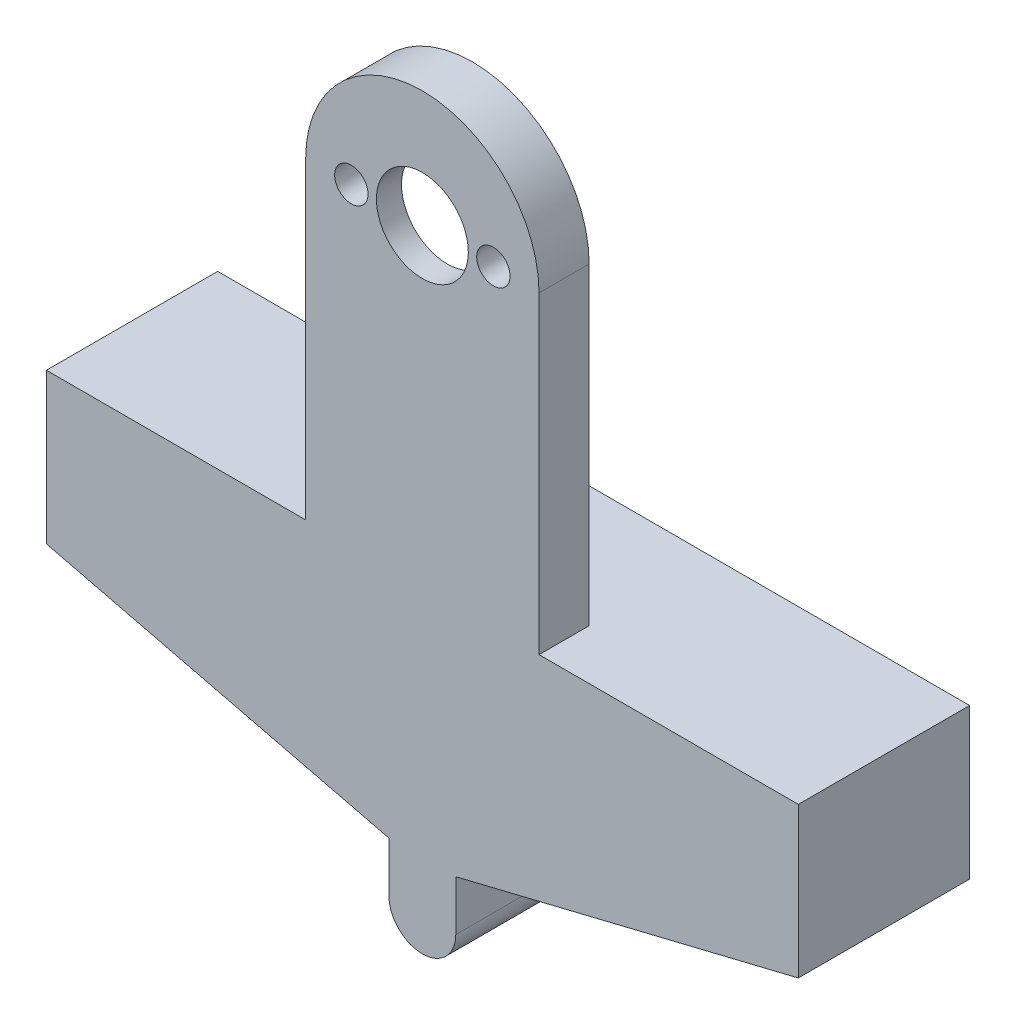
from build123d import *

# Parameters (mm, degrees)
SKETCH1_W           = 15
SKETCH1_H           = 6
SKETCH1_W_2         = 8
SKETCH1_H_2         = 20
BOSS_EXTRUDE1_DEPTH = 14
SKETCH3_W           = 15
SKETCH3_H           = 6
SKETCH3_W_2         = 8
SKETCH3_H_2         = 20
BOSS_EXTRUDE2_DEPTH = 6.5
FILLET1_R           = 4
SKETCH4_R           = 2
SKETCH4_R_2         = 5.5
BOSS_EXTRUDE3_DEPTH = 6
SKETCH5_R           = 12.05
CUT_EXTRUDE1_DEPTH  = 3


with BuildPart() as part:
    # Sketch1 → Boss-Extrude1 (new body)
    # profile 1 of 6: a face of its own
    with BuildSketch(Plane.XY):
        Polygon((-4, -9), (4, -9), (45, -9), (45, 9), (-45, 9), (-45, -9), align=None)
        with Locations((-15, 0)):
            Rectangle(SKETCH1_W, SKETCH1_H, mode=Mode.SUBTRACT)
        with Locations((15, 0)):
            Rectangle(SKETCH1_W, SKETCH1_H, mode=Mode.SUBTRACT)
    # profile 2 of 6: a face of its own
    with BuildSketch(Plane.XY):
        with Locations((0, -19)):
            Rectangle(SKETCH1_W_2, SKETCH1_H_2)
    # profile 3 of 6: a face of its own
    with BuildSketch(Plane.XY):
        with Locations((-15, 0)):
            Rectangle(SKETCH1_W, SKETCH1_H)
    # profile 4 of 6: a face of its own
    with BuildSketch(Plane.XY):
        with Locations((15, 0)):
            Rectangle(SKETCH1_W, SKETCH1_H)
    # profile 5 of 6: a face of its own
    with BuildSketch(Plane.XY):
        Polygon((45, -9), (4, -9), (4, -19), align=None)
    # profile 6 of 6: a face of its own
    with BuildSketch(Plane.XY):
        Polygon((-4, -19), (-4, -9), (-45, -9), align=None)
    extrude(amount=BOSS_EXTRUDE1_DEPTH)

    # Sketch3 → Boss-Extrude2 (add)
    # profile 1 of 2: a face of its own
    with BuildSketch(Plane.XY):
        Polygon((-4, -9), (4, -9), (45, -9), (45, 9), (-45, 9), (-45, -9), align=None)
        with Locations((-15, 0)):
            Rectangle(SKETCH3_W, SKETCH3_H, mode=Mode.SUBTRACT)
        with Locations((15, 0)):
            Rectangle(SKETCH3_W, SKETCH3_H, mode=Mode.SUBTRACT)
    # profile 2 of 2: a face of its own
    with BuildSketch(Plane.XY):
        with Locations((0, -19)):
            Rectangle(SKETCH3_W_2, SKETCH3_H_2)
    extrude(amount=-BOSS_EXTRUDE2_DEPTH)

    # Fillet1
    fillet1_edges = [part.edges().sort_by_distance(p)[0] for p in [
        (-4, -29, 3.75),
        (4, -29, 3.75),
    ]]
    fillet(fillet1_edges, radius=FILLET1_R - 0.0001)  # a hair under: the kernel refuses the full size

    # Sketch4 → Boss-Extrude3 (add)
    with BuildSketch(Plane.XY.offset(14)):
        with BuildLine():
            Line((13.964514824, 9), (13.964514824, 46.5))
            ThreePointArc((13.964514824, 46.5), (0, 60.464514824), (-13.964514824, 46.5))
            Line((-13.964514824, 46.5), (-13.964514824, 9))
            Line((-13.964514824, 9), (13.964514824, 9))
        make_face()
        with Locations((8.5, 46.5)):
            Circle(SKETCH4_R, mode=Mode.SUBTRACT)
        with Locations((-8.5, 46.5)):
            Circle(SKETCH4_R, mode=Mode.SUBTRACT)
        with Locations((0, 46.5)):
            Circle(SKETCH4_R_2, mode=Mode.SUBTRACT)
    extrude(amount=-BOSS_EXTRUDE3_DEPTH)

    # Sketch5 → Cut-Extrude1 (cut)
    with BuildSketch(Plane(origin=(0, 0, 8), x_dir=(-1, 0, 0), z_dir=(0, 0, -1))):
        with Locations((0, 46.5)):
            Circle(SKETCH5_R)
    extrude(amount=-CUT_EXTRUDE1_DEPTH, mode=Mode.SUBTRACT)


solid = part.part
